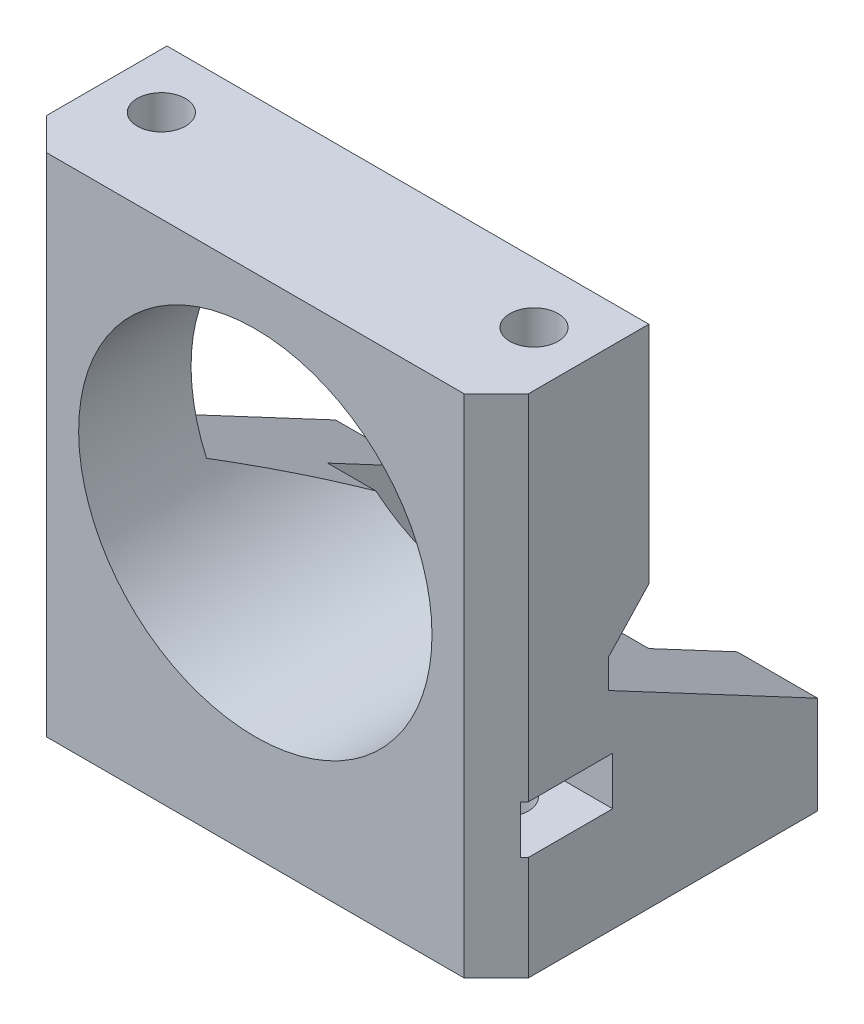
from build123d import *

# Parameters (mm, degrees)
SKETCH1_W                 = 30
SKETCH1_H                 = 28
SKETCH1_R                 = 11
BOSS_EXTRUDE1_DEPTH       = 7
SKETCH2_W                 = 5
SKETCH2_H                 = 2.5
BOSS_EXTRUDE2_DEPTH       = 13
CHAMFER2_SIZE             = 2
BOSS_EXTRUDE6_DEPTH       = 2.5
CHAMFER3_SIZE             = 2
CHAMFER4_SIZE             = 2
BOSS_EXTRUDE4_DEPTH       = 2.5
CHAMFER6_SIZE             = 2.5
CHAMFER7_SIZE             = 7
CHAMFER7_SIZE_2           = 13.165085257
SKETCH7_R                 = 1.5
CUT_EXTRUDE2_DEPTH        = 6.4
CUT_EXTRUDE3_START        = -3
SKETCH9_R                 = 1.5
CUT_EXTRUDE3_DEPTH        = 3
SKETCH10_W                = 5.5
SKETCH10_H                = 3
CUT_EXTRUDE4_DEPTH        = 5.6
CUT_EXTRUDE5_START        = -30
SKETCH10_2_W              = 5.5
SKETCH10_2_H              = 3
CUT_EXTRUDE5_DEPTH        = 5.6
F_1_0MM_DOWEL_HOLE1_D     = 3
F_1_0MM_DOWEL_HOLE1_DEPTH = 7.098709071
F_1_0MM_DOWEL_HOLE1_TIP   = 0.901290929
BOSS_EXTRUDE7_START       = 3.5
SKETCH17_R                = 1.5
BOSS_EXTRUDE7_DEPTH       = 3.5


with BuildPart() as part:
    # Sketch1 → Boss-Extrude1 (new body)
    with BuildSketch(Plane.XY):
        Rectangle(SKETCH1_W, SKETCH1_H)
        Circle(SKETCH1_R, mode=Mode.SUBTRACT)
    extrude(amount=BOSS_EXTRUDE1_DEPTH)

    # Sketch2 → Boss-Extrude2 (add)
    with BuildSketch(Plane(origin=(0, 0, 0), x_dir=(-1, 0, 0), z_dir=(0, 0, -1))):
        with Locations((-12.5, -12.75)):
            Rectangle(SKETCH2_W, SKETCH2_H)
        with Locations((12.5, -12.75)):
            Rectangle(SKETCH2_W, SKETCH2_H)
    extrude(amount=BOSS_EXTRUDE2_DEPTH)

    # Chamfer2
    chamfer2_edges = [part.edges().sort_by_distance(p)[0] for p in [
        (-10, -12.75, 0),
        (10, -12.75, 0),
    ]]
    chamfer(chamfer2_edges, length=CHAMFER2_SIZE)

    # Sketch5 → Boss-Extrude6 (add)
    with BuildSketch(Plane.XZ.offset(14)):
        Polygon((-10, -2), (-10, -7.5), (10, -7.5), (10, -2), (8, 0), (-8, 0), align=None)
    extrude(amount=-BOSS_EXTRUDE6_DEPTH)

    # Chamfer3
    chamfer3_edges = [part.edges().sort_by_distance(p)[0] for p in [
        (15, 0, 7),
    ]]
    chamfer(chamfer3_edges, length=CHAMFER3_SIZE)

    # Chamfer4
    chamfer4_edges = [part.edges().sort_by_distance(p)[0] for p in [
        (-15, 0, 7),
    ]]
    chamfer(chamfer4_edges, length=CHAMFER4_SIZE)

    # Sketch4 → Boss-Extrude4 (add)
    with BuildSketch(Plane(origin=(0, 0, 0), x_dir=(-1, 0, 0), z_dir=(0, 0, -1))):
        Polygon((-15, 0), (15, 11.5), (15, 14), (-15, 14), align=None)
    extrude(amount=BOSS_EXTRUDE4_DEPTH)

    # Chamfer6
    # the kernel refuses this chamfer: 2.5 mm, written as the material it adds along each edge
    with BuildSketch(Plane(origin=(21.003247512, -2.30124488, 0), x_dir=(-0.3578006820796162, -0.9333930836859554, 0.02749587661058638), z_dir=(-0.9337461173020497, 0.35793601163245237, 0))) as chamfer6_piece_1_section:
        Polygon((CHAMFER6_SIZE * 0.999621916911, -CHAMFER6_SIZE * 0.0274958766106), (-CHAMFER6_SIZE * 0.0274958766106, -CHAMFER6_SIZE * 0.999621916911), (0, 0), align=None)
    chamfer6_piece_1 = extrude(amount=17.263908412, mode=Mode.PRIVATE)
    chamfer6_piece_1 = chamfer6_piece_1 - Plane(origin=(0, 0, -0.835393566), x_dir=(1, 0, 0), z_dir=(0, 0, -1)) * Cylinder(11, 45, mode=Mode.PRIVATE)
    chamfer6_piece_1 = split(chamfer6_piece_1, bisect_by=Plane(origin=(15, -0.113968884, -0.835393566), z_dir=(-1, 0, 0)), keep=Keep.TOP, mode=Mode.PRIVATE)
    add(chamfer6_piece_1)
    with BuildSketch(Plane(origin=(-1.03959441, 6.148511191, 0), x_dir=(-0.35780068207961624, -0.9333930836859554, 0.02749587661058638), z_dir=(-0.9337461173020497, 0.35793601163245237, 0))) as chamfer6_piece_2_section:
        Polygon((CHAMFER6_SIZE * 0.999621916911, -CHAMFER6_SIZE * 0.0274958766106), (-CHAMFER6_SIZE * 0.0274958766106, -CHAMFER6_SIZE * 0.999621916911), (0, 0), align=None)
    chamfer6_piece_2 = extrude(amount=21.380172546, mode=Mode.PRIVATE)
    chamfer6_piece_2 = chamfer6_piece_2 - Plane(origin=(0, 0, -0.851534645), x_dir=(1, 0, 0), z_dir=(0, 0, -1)) * Cylinder(11, 53, mode=Mode.PRIVATE)
    chamfer6_piece_2 = split(chamfer6_piece_2, bisect_by=Plane(origin=(-15, 9.244820467, -0.851534645), z_dir=(1, 0, 0)), keep=Keep.TOP, mode=Mode.PRIVATE)
    add(chamfer6_piece_2)

    # Chamfer7
    # the kernel refuses this chamfer: 13.165085257, 7 mm, written as the material it adds along each edge
    with BuildSketch(Plane(origin=(-15, -11.5, 0), x_dir=(0, 0.9979482451756082, 0.06402577567608186), z_dir=(1, 0, 0))) as chamfer7_piece_1_section:
        Polygon((CHAMFER7_SIZE * 0.997948245176, -CHAMFER7_SIZE * 0.0640257756761), (-CHAMFER7_SIZE_2 * 0.0640257756781, -CHAMFER7_SIZE_2 * 0.997948245208), (0, 0), align=None)
    chamfer7_piece_1 = extrude(amount=30, mode=Mode.PRIVATE)
    chamfer7_piece_1 = chamfer7_piece_1 - Plane(origin=(0, 0, -3.073682767), x_dir=(1, 0, 0), z_dir=(0, 0, -1)) * Cylinder(11, 113, mode=Mode.PRIVATE)
    chamfer7_piece_1 = split(chamfer7_piece_1, bisect_by=Plane(origin=(-10, -8.887755394, -3.073682767), z_dir=(-1, 0, 0)), keep=Keep.TOP, mode=Mode.PRIVATE)
    chamfer7_piece_1 = split(chamfer7_piece_1, bisect_by=Plane(origin=(-12.500128058, -8.887755394, -7.5), z_dir=(0, 0, 1)), keep=Keep.TOP, mode=Mode.PRIVATE)
    add(chamfer7_piece_1)
    with BuildSketch(Plane(origin=(-15, -11.5, 0), x_dir=(0, 0.9979482451756082, 0.06402577567608186), z_dir=(1, 0, 0))) as chamfer7_piece_2_section:
        Polygon((CHAMFER7_SIZE * 0.997948245176, -CHAMFER7_SIZE * 0.0640257756761), (-CHAMFER7_SIZE_2 * 0.0640257756781, -CHAMFER7_SIZE_2 * 0.997948245208), (0, 0), align=None)
    chamfer7_piece_2 = extrude(amount=30, mode=Mode.PRIVATE)
    chamfer7_piece_2 = split(chamfer7_piece_2, bisect_by=Plane(origin=(-10, -10.721530873, -9.597564575), z_dir=(-1, 0, 0)), keep=Keep.TOP, mode=Mode.PRIVATE)
    chamfer7_piece_2 = split(chamfer7_piece_2, bisect_by=Plane(origin=(-12.5, -10.721530873, -7.5), z_dir=(0, 0, -1)), keep=Keep.TOP, mode=Mode.PRIVATE)
    chamfer7_piece_2 = split(chamfer7_piece_2, bisect_by=Plane(origin=(-12.5, -10.721530873, -13), z_dir=(0, 0, 1)), keep=Keep.TOP, mode=Mode.PRIVATE)
    add(chamfer7_piece_2)
    with BuildSketch(Plane(origin=(-15, -11.5, 0), x_dir=(0, 0.9979482451756082, 0.06402577567608186), z_dir=(1, 0, 0))) as chamfer7_piece_3_section:
        Polygon((CHAMFER7_SIZE * 0.997948245176, -CHAMFER7_SIZE * 0.0640257756761), (-CHAMFER7_SIZE_2 * 0.0640257756781, -CHAMFER7_SIZE_2 * 0.997948245208), (0, 0), align=None)
    chamfer7_piece_3 = extrude(amount=30, mode=Mode.PRIVATE)
    chamfer7_piece_3 = chamfer7_piece_3 - Plane(origin=(0, 0, -3.793876077), x_dir=(1, 0, 0), z_dir=(0, 0, -1)) * Cylinder(11, 113, mode=Mode.PRIVATE)
    chamfer7_piece_3 = split(chamfer7_piece_3, bisect_by=Plane(origin=(-10, -6.598719884, -3.793876077), z_dir=(1, 0, 0)), keep=Keep.TOP, mode=Mode.PRIVATE)
    chamfer7_piece_3 = split(chamfer7_piece_3, bisect_by=Plane(origin=(-9.499486782, -6.598719884, -7.5), z_dir=(0, 0, 1)), keep=Keep.TOP, mode=Mode.PRIVATE)
    chamfer7_piece_3 = split(chamfer7_piece_3, bisect_by=Plane(origin=(10, -6.598719884, -3.793876077), z_dir=(-1, 0, 0)), keep=Keep.TOP, mode=Mode.PRIVATE)
    add(chamfer7_piece_3)
    with BuildSketch(Plane(origin=(-15, -11.5, 0), x_dir=(0, 0.9979482451756082, 0.06402577567608186), z_dir=(1, 0, 0))) as chamfer7_piece_4_section:
        Polygon((CHAMFER7_SIZE * 0.997948245176, -CHAMFER7_SIZE * 0.0640257756761), (-CHAMFER7_SIZE_2 * 0.0640257756781, -CHAMFER7_SIZE_2 * 0.997948245208), (0, 0), align=None)
    chamfer7_piece_4 = extrude(amount=30, mode=Mode.PRIVATE)
    chamfer7_piece_4 = split(chamfer7_piece_4, bisect_by=Plane(origin=(12.5, -10.721530873, -7.5), z_dir=(0, 0, -1)), keep=Keep.TOP, mode=Mode.PRIVATE)
    chamfer7_piece_4 = split(chamfer7_piece_4, bisect_by=Plane(origin=(10, -10.721530873, -9.597564575), z_dir=(1, 0, 0)), keep=Keep.TOP, mode=Mode.PRIVATE)
    chamfer7_piece_4 = split(chamfer7_piece_4, bisect_by=Plane(origin=(12.5, -10.721530873, -13), z_dir=(0, 0, 1)), keep=Keep.TOP, mode=Mode.PRIVATE)
    add(chamfer7_piece_4)
    with BuildSketch(Plane(origin=(-15, -11.5, 0), x_dir=(0, 0.9979482451756082, 0.06402577567608186), z_dir=(1, 0, 0))) as chamfer7_piece_5_section:
        Polygon((CHAMFER7_SIZE * 0.997948245176, -CHAMFER7_SIZE * 0.0640257756761), (-CHAMFER7_SIZE_2 * 0.0640257756781, -CHAMFER7_SIZE_2 * 0.997948245208), (0, 0), align=None)
    chamfer7_piece_5 = extrude(amount=30, mode=Mode.PRIVATE)
    chamfer7_piece_5 = chamfer7_piece_5 - Plane(origin=(0, 0, -3.073682766), x_dir=(1, 0, 0), z_dir=(0, 0, -1)) * Cylinder(11, 113, mode=Mode.PRIVATE)
    chamfer7_piece_5 = split(chamfer7_piece_5, bisect_by=Plane(origin=(12.500128057, -8.887755394, -7.5), z_dir=(0, 0, 1)), keep=Keep.TOP, mode=Mode.PRIVATE)
    chamfer7_piece_5 = split(chamfer7_piece_5, bisect_by=Plane(origin=(10, -8.887755394, -3.073682766), z_dir=(1, 0, 0)), keep=Keep.TOP, mode=Mode.PRIVATE)
    add(chamfer7_piece_5)

    # Sketch7 → Cut-Extrude2 (cut)
    with BuildSketch(Plane.XZ.offset(14)):
        with Locations(Location((-11, 2.5, 0), (0, 0, 270))):
            Circle(SKETCH7_R)
        with Locations(Location((11, 2.5, 0), (0, 0, 270))):
            Circle(SKETCH7_R)
    extrude(amount=-CUT_EXTRUDE2_DEPTH, mode=Mode.SUBTRACT)

    # Sketch9 → Cut-Extrude3 (cut)
    # profile 1 of 2: a face of its own
    with BuildSketch(Plane.XZ.offset(14).offset(CUT_EXTRUDE3_START)):
        Polygon((7.824573519, 2.5), (9.41228676, -0.25), (12.58771324, -0.25), (14.175426481, 2.5), (12.58771324, 5.25), (9.41228676, 5.25), align=None)
        with Locations(Location((11, 2.5, 0), (0, 0, 270))):
            Circle(SKETCH9_R, mode=Mode.SUBTRACT)
    # profile 2 of 2: a face of its own
    with BuildSketch(Plane.XZ.offset(14).offset(CUT_EXTRUDE3_START)):
        Polygon((-7.824573519, 2.5), (-9.41228676, 5.25), (-12.58771324, 5.25), (-14.175426481, 2.5), (-12.58771324, -0.25), (-9.41228676, -0.25), align=None)
        with Locations(Location((-11, 2.5, 0), (0, 0, 270))):
            Circle(SKETCH9_R, mode=Mode.SUBTRACT)
    extrude(amount=-CUT_EXTRUDE3_DEPTH, mode=Mode.SUBTRACT)

    # Sketch10 → Cut-Extrude4 (cut)
    with BuildSketch(Plane(origin=(15, 0, 0), x_dir=(0, 0, -1), z_dir=(1, 0, 0))):
        with Locations((-2.5, -9.5)):
            Rectangle(SKETCH10_W, SKETCH10_H)
    extrude(amount=-CUT_EXTRUDE4_DEPTH, mode=Mode.SUBTRACT)

    # Sketch10<2> → Cut-Extrude5 (cut)
    with BuildSketch(Plane(origin=(15, 0, 0), x_dir=(0, 0, -1), z_dir=(1, 0, 0)).offset(CUT_EXTRUDE5_START)):
        with Locations((-2.5, -9.5)):
            Rectangle(SKETCH10_2_W, SKETCH10_2_H)
    extrude(amount=CUT_EXTRUDE5_DEPTH, mode=Mode.SUBTRACT)

    # Ø1.0mm Dowel Hole1
    with Locations(Plane(origin=(0, 14, 0), x_dir=(1, 0, 0), z_dir=(0, 1, 0))):
        with Locations((-11.6, -1.25), (11.6, -1.25)):
            Hole(F_1_0MM_DOWEL_HOLE1_D / 2, depth=F_1_0MM_DOWEL_HOLE1_DEPTH)
            with Locations((0, 0, -(F_1_0MM_DOWEL_HOLE1_DEPTH + F_1_0MM_DOWEL_HOLE1_TIP / 2))):  # 118° drill point
                Cone(0, F_1_0MM_DOWEL_HOLE1_D / 2, F_1_0MM_DOWEL_HOLE1_TIP, mode=Mode.SUBTRACT)

    # Sketch17 → Boss-Extrude7 (add)
    with BuildSketch(Plane.XZ.offset(14).offset(BOSS_EXTRUDE7_START)):
        Polygon((13, 7), (-13, 7), (-15, 5), (-15, -13), (-10, -13), (-10, -7.5), (10, -7.5), (10, -13), (15, -13), (15, 5), align=None)
        with Locations(Location((-11, 2.5, 0), (0, 0, 270))):
            Circle(SKETCH17_R, mode=Mode.SUBTRACT)
        with Locations(Location((11, 2.5, 0), (0, 0, 270))):
            Circle(SKETCH17_R, mode=Mode.SUBTRACT)
    extrude(amount=-BOSS_EXTRUDE7_DEPTH)


solid = part.part
